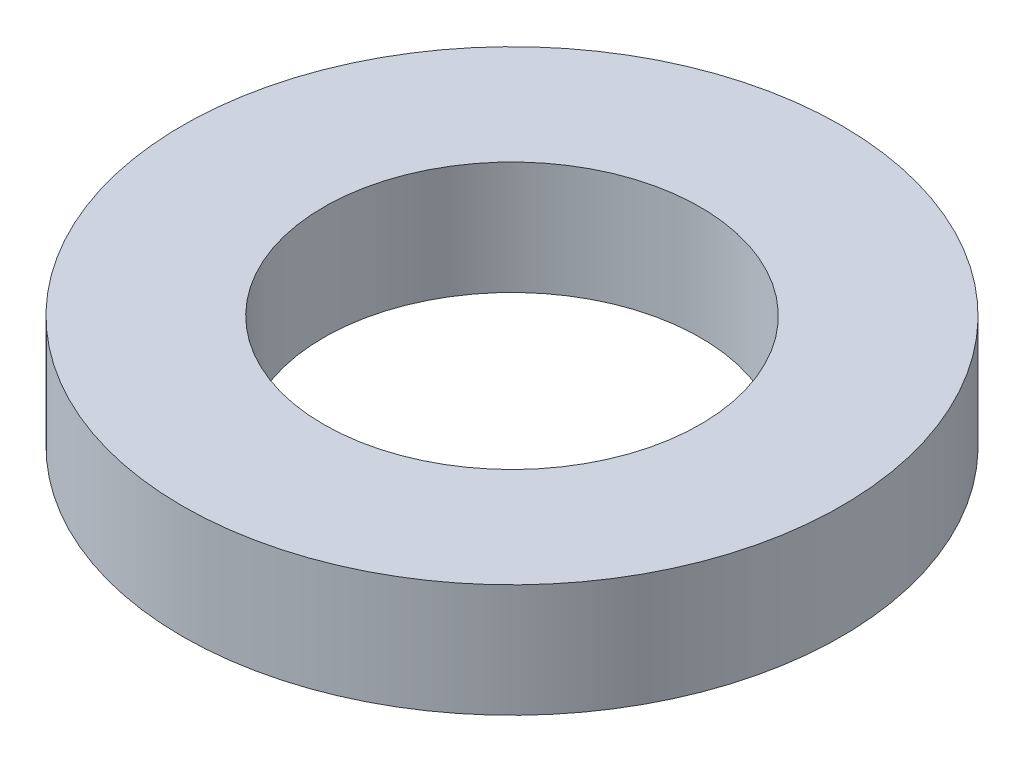
from build123d import *

# Parameters (mm, degrees)
SKETCH1_R           = 52.5
BOSS_EXTRUDE1_DEPTH = 18
SKETCH2_R           = 30
CUT_EXTRUDE1_DEPTH  = 77.396989469


with BuildPart() as part:
    # Sketch1 → Boss-Extrude1 (new body)
    with BuildSketch(Plane(origin=(0, 0, 0), x_dir=(1, 0, 0), z_dir=(0, 1, 0))):
        Circle(SKETCH1_R)
    extrude(amount=BOSS_EXTRUDE1_DEPTH)

    # Sketch2 → Cut-Extrude1 (cut, through all)
    with BuildSketch(Plane(origin=(0, 0, 0), x_dir=(1, 0, 0), z_dir=(0, 1, 0))):
        Circle(SKETCH2_R)
    extrude(amount=CUT_EXTRUDE1_DEPTH, mode=Mode.SUBTRACT)


solid = part.part
